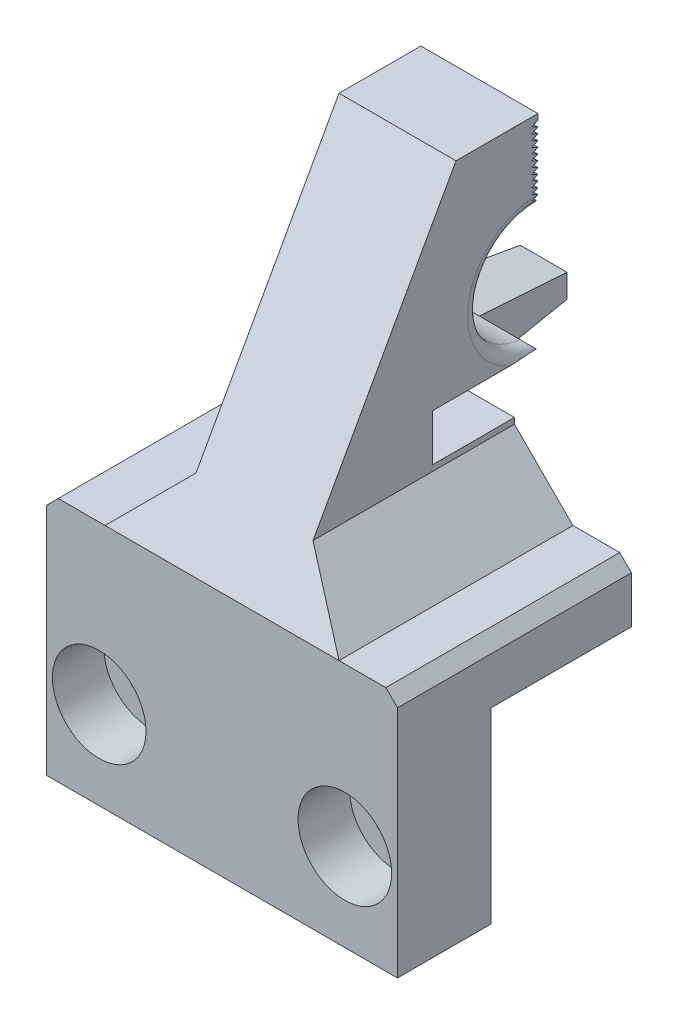
from build123d import *

# Parameters (mm, degrees)
AUFSATZ_LINEAR_AUSTRAGEN1_OUTLINE_W                  = 30
AUFSATZ_LINEAR_AUSTRAGEN1_OUTLINE_H                  = 17
AUFSATZ_LINEAR_AUSTRAGEN1_DEPTH                      = 9
SKIZZE3_W                                            = 30
SKIZZE3_H                                            = 20
AUFSATZ_LINEAR_AUSTRAGEN2_DEPTH                      = 4
FASE1_SIZE                                           = 5
SKIZZE7_W                                            = 10
SKIZZE7_H                                            = 7
AUFSATZ_LINEAR_AUSTRAGEN3_DEPTH                      = 2
SCHNITT_LINEAR_AUSTRAGEN1_DEPTH                      = 45.206900067
LINEARES_MUSTER1_COUNT                               = 12
LINEARES_MUSTER1_PITCH                               = 0.5
AUFSATZ_LINEAR_START                                 = -5
AUFSATZ_LINEAR_AUSTRAGEN4_DEPTH                      = 10
SCHNITT_LINEAR_AUSTRAGEN2_DEPTH                      = 45.206900067
SCHNITT_LINEAR_AUSTRAGEN2_DEPTH_BACK                 = 45.206900067
SKIZZE10_W                                           = 5
SKIZZE10_H                                           = 4
AUFSATZ_LINEAR_AUSTRAGEN5_DEPTH                      = 2
SKIZZE13_W                                           = 5
SKIZZE13_H                                           = 4
SCHNITT_LINEAR_AUSTRAGEN3_DEPTH                      = 9
FASE2_SIZE                                           = 0.5
VERRUNDUNG1_R                                        = 1
STIRNSENKUNG_F_R_M4_ZYLINDERSCHRAUBE_MIT_D           = 4.5
STIRNSENKUNG_F_R_M4_ZYLINDERSCHRAUBE_MIT_CBORE_D     = 8
STIRNSENKUNG_F_R_M4_ZYLINDERSCHRAUBE_MIT_CBORE_DEPTH = 4.4
SKIZZE18_W                                           = 30
SKIZZE18_H                                           = 11
AUFSATZ_LINEAR_AUSTRAGEN6_DEPTH                      = 2
FASE3_SIZE                                           = 1


with BuildPart() as part:
    # Aufsatz-Linear austragen1: read off the stored shape, not the designer's step
    # Aufsatz-Linear austragen1 outline → Aufsatz-Linear austragen1 (new body)
    with BuildSketch(Plane.XY):
        Rectangle(AUFSATZ_LINEAR_AUSTRAGEN1_OUTLINE_W, AUFSATZ_LINEAR_AUSTRAGEN1_OUTLINE_H)
    extrude(amount=AUFSATZ_LINEAR_AUSTRAGEN1_DEPTH)

    # Skizze3 → Aufsatz-Linear austragen2 (add)
    with BuildSketch(Plane(origin=(0, 8.5, 0), x_dir=(1, 0, 0), z_dir=(0, 1, 0))):
        with Locations((0, 1)):
            Rectangle(SKIZZE3_W, SKIZZE3_H)
    extrude(amount=AUFSATZ_LINEAR_AUSTRAGEN2_DEPTH)

    # Skizze4 → Ausformung1 section 0
    with BuildSketch(Plane(origin=(0, 39.5, 0), x_dir=(1, 0, 0), z_dir=(0, 1, 0))):
        with BuildLine():
            Line((-5, 11), (5, 11))
            Line((5, 11), (5, 6))
            Line((5, 6), (-5, 6))
            Line((-5, 6), (-5, 11))
        make_face()
    # Skizze5 → Ausformung1 section 1
    with BuildSketch(Plane(origin=(0, 12.5, 0), x_dir=(1, 0, 0), z_dir=(0, 1, 0))):
        with BuildLine():
            Line((-5, 11), (5, 11))
            Line((5, 11), (5, -9))
            Line((5, -9), (-5, -9))
            Line((-5, -9), (-5, 11))
        make_face()
    loft()

    # Fase1
    fase1_edges = [part.edges().sort_by_distance(p)[0] for p in [
        (5, 12.5, -1),
        (-5, 12.5, -1),
    ]]
    chamfer(fase1_edges, length=FASE1_SIZE)

    # Skizze7 → Aufsatz-Linear austragen3 (add)
    with BuildSketch(Plane(origin=(0, 0, -11), x_dir=(-1, 0, 0), z_dir=(0, 0, -1))):
        with Locations((0, 36)):
            Rectangle(SKIZZE7_W, SKIZZE7_H)
    extrude(amount=AUFSATZ_LINEAR_AUSTRAGEN3_DEPTH)

    # Skizze6 → Schnitt-Linear austragen1 (cut, symmetric)
    with BuildSketch(Plane(origin=(0, 0, 0), x_dir=(0, 0, -1), z_dir=(1, 0, 0))):
        Polygon((13, 39), (12.5, 38.75), (13, 38.5), align=None)
    schnitt_linear_austragen1 = extrude(amount=SCHNITT_LINEAR_AUSTRAGEN1_DEPTH, both=True, mode=Mode.SUBTRACT)

    # Lineares Muster1: Schnitt-Linear austragen1 ×12
    with Locations(*[(0, -i * LINEARES_MUSTER1_PITCH, 0) for i in range(1, LINEARES_MUSTER1_COUNT)]):
        add(schnitt_linear_austragen1, mode=Mode.SUBTRACT)

    # Skizze8 → Aufsatz-Linear austragen4 (add)
    with BuildSketch(Plane(origin=(0, 0, 0), x_dir=(0, 0, -1), z_dir=(1, 0, 0)).offset(AUFSATZ_LINEAR_START)):
        with BuildLine():
            ThreePointArc((11, 32.082575695), (11.978451782, 32.394531565), (13, 32.5))
            Line((13, 32.5), (11, 32.5))
            Line((11, 32.5), (11, 32.082575695))
        make_face()
        with BuildLine():
            Line((11, 22.917424305), (11, 22))
            Line((11, 22), (13, 22))
            Line((13, 22), (13, 22.5))
            ThreePointArc((13, 22.5), (11.978451782, 22.605468435), (11, 22.917424305))
        make_face()
    extrude(amount=AUFSATZ_LINEAR_AUSTRAGEN4_DEPTH)

    # Skizze9 → Schnitt-Linear austragen2 (cut, two sides: drawn at the far end of the back side and taken through both)
    with BuildSketch(Plane(origin=(0, 0, 0), x_dir=(0, 0, -1), z_dir=(1, 0, 0)).offset(-SCHNITT_LINEAR_AUSTRAGEN2_DEPTH_BACK)):
        with BuildLine():
            Line((11, 32.082575695), (11, 22.917424305))
            ThreePointArc((11, 22.917424305), (8, 27.5), (11, 32.082575695))
        make_face()
    extrude(amount=SCHNITT_LINEAR_AUSTRAGEN2_DEPTH + SCHNITT_LINEAR_AUSTRAGEN2_DEPTH_BACK, mode=Mode.SUBTRACT)

    # Skizze10 → Aufsatz-Linear austragen5 (add)
    with BuildSketch(Plane(origin=(0, 0, -11), x_dir=(-1, 0, 0), z_dir=(0, 0, -1))):
        with Locations((2.5, 20)):
            Rectangle(SKIZZE10_W, SKIZZE10_H)
    extrude(amount=AUFSATZ_LINEAR_AUSTRAGEN5_DEPTH)

    # Skizze12 → Ausformung2 section 0
    with BuildSketch(Plane(origin=(0, 0, -21), x_dir=(-1, 0, 0), z_dir=(0, 0, -1))):
        with BuildLine():
            Line((0.5, 21), (4.5, 21))
            Line((4.5, 21), (4.5, 19))
            Line((4.5, 19), (0.5, 19))
            Line((0.5, 19), (0.5, 21))
        make_face()
    # Skizze11 → Ausformung2 section 1
    with BuildSketch(Plane(origin=(0, 0, -13), x_dir=(-1, 0, 0), z_dir=(0, 0, -1))):
        with BuildLine():
            Line((0, 18), (5, 18))
            Line((5, 18), (5, 22))
            Line((5, 22), (0, 22))
            Line((0, 22), (0, 18))
        make_face()
    loft()

    # Skizze13 → Schnitt-Linear austragen3 (cut)
    with BuildSketch(Plane(origin=(0, 0, -13), x_dir=(-1, 0, 0), z_dir=(0, 0, -1))):
        with Locations((-2.5, 20)):
            Rectangle(SKIZZE13_W, SKIZZE13_H)
    extrude(amount=-SCHNITT_LINEAR_AUSTRAGEN3_DEPTH, mode=Mode.SUBTRACT)

    # Fase2
    # the kernel refuses this chamfer: 0.5 mm, written as the material it takes off along each edge
    with BuildSketch(Plane(origin=(-6.359313388, 22.5, -13), x_dir=(0, 0.05286907949936605, 0.9986014522485384), z_dir=(1, 0, 0))) as fase2_piece_1:
        with BuildLine():
            Line((0.528690795, 0), (-FASE2_SIZE * 0.0528690794994, FASE2_SIZE * 0.998601452249))
            Line((-FASE2_SIZE * 0.0528690794994, FASE2_SIZE * 0.998601452249), (0, 0))
            ThreePointArc((0, 0), (0.271800807, 0.00698718), (0.528690795, 0))
        make_face()
    extrude(amount=12.718626777, mode=Mode.SUBTRACT)

    # Verrundung1
    # the kernel refuses this fillet: 1 mm, written as the material it takes off along each edge
    with BuildSketch(Plane(origin=(5, 27.5, -13), x_dir=(0, -0.9230106794344456, -0.38477433080958384), z_dir=(0, 0.38477433080958384, -0.9230106794344456))) as verrundung1_piece_1:
        with BuildLine():
            CenterArc((5 + VERRUNDUNG1_R, VERRUNDUNG1_R), VERRUNDUNG1_R, 180, 90)
            Line((5, VERRUNDUNG1_R), (5, 0))
            Line((5, 0), (5 + VERRUNDUNG1_R, 0))
        make_face()
    revolve(axis=Axis((5, 27.5, -13), (-1, 0, 0)), revolution_arc=231.320638443, mode=Mode.SUBTRACT)
    with BuildSketch(Plane(origin=(-5, 27.5, -13), x_dir=(0, 0.8772223630986392, -0.4800842901820881), z_dir=(0, -0.4800842901820881, -0.8772223630986392))) as verrundung1_piece_2:
        with BuildLine():
            CenterArc((5 + VERRUNDUNG1_R, VERRUNDUNG1_R), VERRUNDUNG1_R, 180, 90)
            Line((5, VERRUNDUNG1_R), (5, 0))
            Line((5, 0), (5 + VERRUNDUNG1_R, 0))
        make_face()
    revolve(axis=Axis((-5, 27.5, -13), (1, 0, 0)), revolution_arc=231.320638443, mode=Mode.SUBTRACT)

    # Stirnsenkung für M4 Zylinderschraube mit Innensechskant1 (through all)
    with Locations(Plane.XY.offset(9)):
        with Locations((-10.5, -1), (10.5, -1)):
            CounterBoreHole(STIRNSENKUNG_F_R_M4_ZYLINDERSCHRAUBE_MIT_D / 2, STIRNSENKUNG_F_R_M4_ZYLINDERSCHRAUBE_MIT_CBORE_D / 2, STIRNSENKUNG_F_R_M4_ZYLINDERSCHRAUBE_MIT_CBORE_DEPTH)

    # Skizze18 → Aufsatz-Linear austragen6 (add)
    with BuildSketch(Plane.XZ.offset(-8.5)):
        with Locations((0, -5.5)):
            Rectangle(SKIZZE18_W, SKIZZE18_H)
    extrude(amount=AUFSATZ_LINEAR_AUSTRAGEN6_DEPTH)

    # Fase3
    fase3_edges = [part.edges().sort_by_distance(p)[0] for p in [
        (-15, -1, 0),
        (15, -1, 0),
        (15, 6.5, -5.5),
        (-15, 6.5, -5.5),
        (0, 6.5, -11),
        (15, 12.5, -1),
        (-15, 12.5, -1),
    ]]
    chamfer(fase3_edges, length=FASE3_SIZE)


solid = part.part
